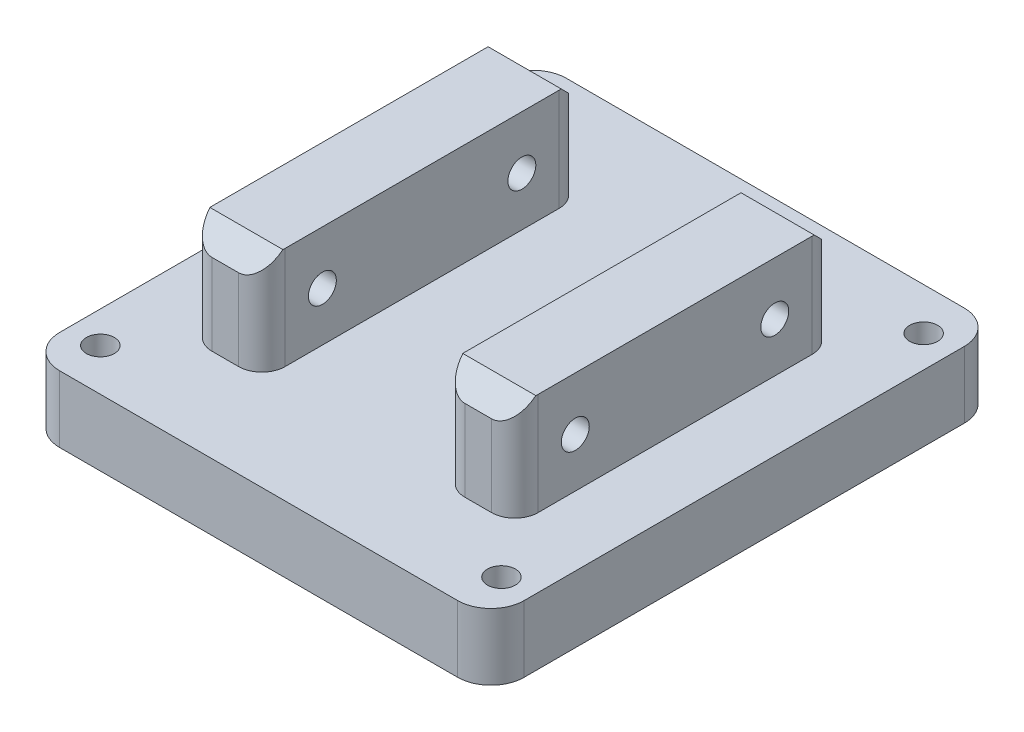
from build123d import *

# Parameters (mm, degrees)
BOSS_EXTRUDE1_DEPTH         = 38.1
SKETCH2_W                   = 49.038
SKETCH2_H                   = 14
CUT_EXTRUDE1_DEPTH          = 15.4
FILLET1_R                   = 3.5
TAP_DRILL_FOR_M5X0_8_TAP2_D = 4.2
TAP_DRILL_FOR_M5X0_8_TAP3_D = 4.2
CHAMFER1_SIZE               = 3.175
FILLET4_R                   = 5


with BuildPart() as part:
    # Sketch1 → Boss-Extrude1 (new, symmetric)
    with BuildSketch(Plane.XY):
        Polygon((-24.519, 25.4), (-24.519, 10), (-34.925, 10), (-34.925, 0), (34.925, 0), (34.925, 10), (24.519, 10), (24.519, 25.4), (13.519, 25.4), (13.519, 10), (-13.519, 10), (-13.519, 25.4), align=None)
    extrude(amount=BOSS_EXTRUDE1_DEPTH, both=True)

    # Sketch2 → Cut-Extrude1 (cut)
    with BuildSketch(Plane(origin=(0, 25.4, 0), x_dir=(1, 0, 0), z_dir=(0, 1, 0))):
        with Locations((0, 31.1)):
            Rectangle(SKETCH2_W, SKETCH2_H)
        with Locations((0, -31.1)):
            Rectangle(SKETCH2_W, SKETCH2_H)
    extrude(amount=-CUT_EXTRUDE1_DEPTH, mode=Mode.SUBTRACT)

    # Fillet1
    fillet1_edges = [part.edges().sort_by_distance(p)[0] for p in [
        (-13.519, 17.7, -24.1),
        (13.519, 17.7, -24.1),
        (24.519, 17.7, -24.1),
        (-24.519, 17.7, -24.1),
        (-13.519, 17.7, 24.1),
        (13.519, 17.7, 24.1),
        (-24.519, 17.7, 24.1),
        (24.519, 17.7, 24.1),
    ]]
    fillet(fillet1_edges, radius=FILLET1_R)

    # Tap Drill for M5x0.8 Tap2 (through all)
    with Locations(Plane(origin=(0, 0, 0), x_dir=(-1, 0, 0), z_dir=(0, -1, 0))):
        with Locations((-30.1625, 31.75), (30.1625, 31.75), (30.1625, -31.75), (-30.1625, -31.75)):
            Hole(TAP_DRILL_FOR_M5X0_8_TAP2_D / 2)

    # Tap Drill for M5x0.8 Tap3 (through all)
    with Locations(Plane.ZY.offset(24.519)):
        with Locations((-15, 17.4), (15, 17.4)):
            Hole(TAP_DRILL_FOR_M5X0_8_TAP3_D / 2)

    # Chamfer1
    # the kernel refuses this chamfer: 3.175 mm, written as the material it takes off along each edge
    with BuildSketch(Plane(origin=(29.184093487, 25.4, -24.1), x_dir=(0, -0.9996219169112968, -0.027495876610586726), z_dir=(-1, 0, 0)), Plane(origin=(-8.853906513, 25.4, 24.1), x_dir=(0, 0.027495876610586726, -0.9996219169112968), z_dir=(-1, 0, 0))) as chamfer1_piece_1:
        Polygon((CHAMFER1_SIZE * 0.999621916911, CHAMFER1_SIZE * 0.0274958766106), (-CHAMFER1_SIZE * 0.0274958766106, CHAMFER1_SIZE * 0.999621916911), (0, 0), align=None)
    extrude(amount=20.330186974, mode=Mode.SUBTRACT)
    with BuildSketch(Plane(origin=(29.184093487, 25.4, 24.1), x_dir=(0, -0.9996219169112968, 0.027495876610586726), z_dir=(-1, 0, 0)), Plane(origin=(-8.853906513, 25.4, -24.1), x_dir=(0, 0.027495876610586726, 0.9996219169112968), z_dir=(-1, 0, 0))) as chamfer1_piece_2:
        Polygon((CHAMFER1_SIZE * 0.999621916911, -CHAMFER1_SIZE * 0.0274958766106), (-CHAMFER1_SIZE * 0.0274958766106, -CHAMFER1_SIZE * 0.999621916911), (0, 0), align=None)
    extrude(amount=20.330186974, mode=Mode.SUBTRACT)

    # Fillet4
    fillet4_edges = [part.edges().sort_by_distance(p)[0] for p in [
        (-34.925, 5, 38.1),
        (34.925, 5, -38.1),
        (-34.925, 5, -38.1),
        (34.925, 5, 38.1),
    ]]
    fillet(fillet4_edges, radius=FILLET4_R)


solid = part.part
